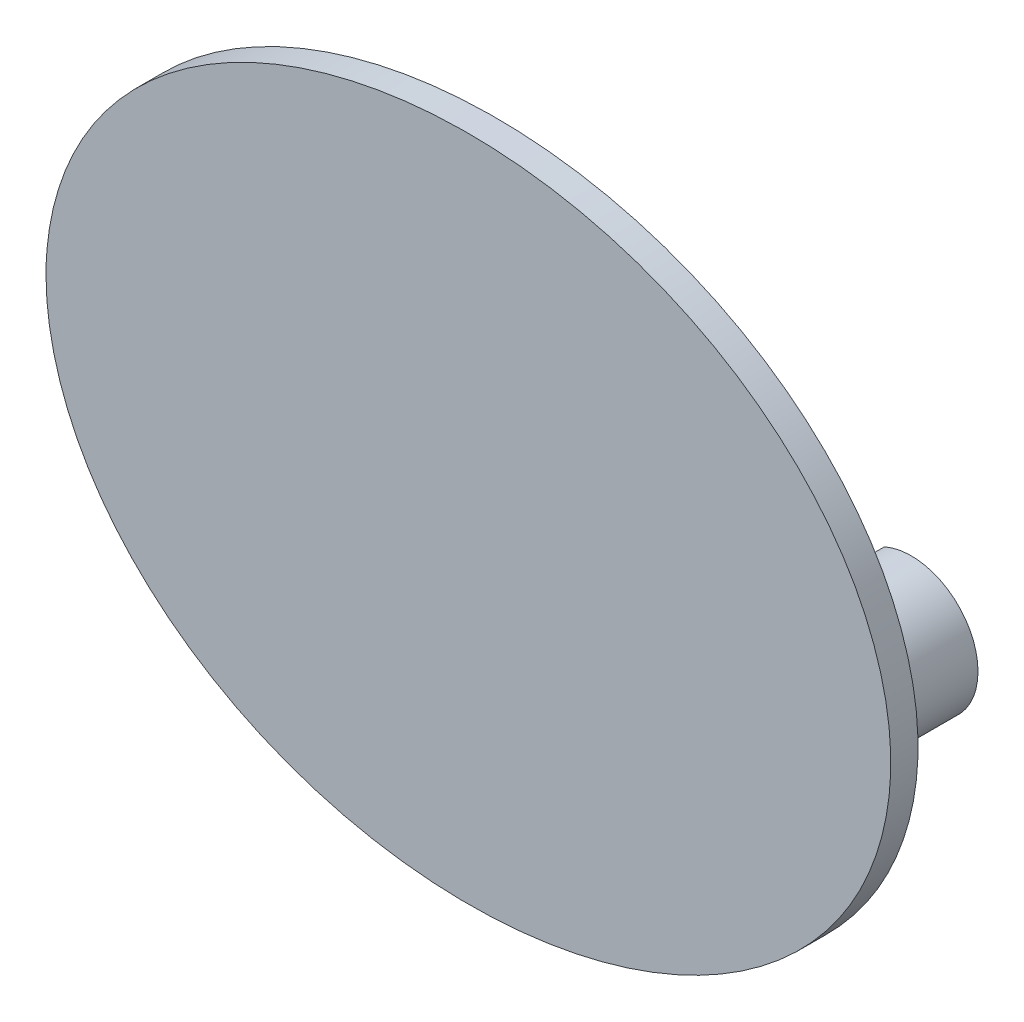
from build123d import *

# Parameters (mm, degrees)
BOSS_EXTRUDE1_DEPTH = 2
BOSS_EXTRUDE2_DEPTH = 7
CUT_EXTRUDE3_DEPTH  = 2.5


# Read off the part's stored shape, not the designer's step: Boss-Extrude1
with BuildPart() as part:
    # Boss-Extrude1 outline → Boss-Extrude1 (new body)
    with BuildSketch(Plane.XY):
        with BuildLine():
            add(Edge.make_bspline(
                [(-31, 0), (-31, -3.366346592), (-29.206076059, -10.099039775), (-22.015870133, -18.167897158), (-11.794763727, -23.318217271), (0, -25.090891365), (11.794763727, -23.318217271), (22.015870133, -18.167897158), (29.206076059, -10.099039775), (31.896961971, 0), (29.206076059, 10.099039775), (22.015870133, 18.167897158), (11.794763727, 23.318217271), (0, 25.090891365), (-11.794763727, 23.318217271), (-22.015870133, 18.167897158), (-29.206076059, 10.099039775), (-31, 3.366346592), (-31, 0)],
                knots=[0, 0, 0, 0, 0.392699082, 0.785398163, 1.178097245, 1.570796327, 1.963495408, 2.35619449, 2.748893572, 3.141592654, 3.534291735, 3.926990817, 4.319689899, 4.71238898, 5.105088062, 5.497787144, 5.890486225, 6.283185307, 6.283185307, 6.283185307, 6.283185307], degree=3))
        make_face()
    extrude(amount=BOSS_EXTRUDE1_DEPTH)

    # Sketch3 → Boss-Extrude2 (add)
    with BuildSketch(Plane.XY):
        with BuildLine():
            ThreePointArc((-21.537021277, 4.489622983), (-28.4, 0), (-21.537021277, -4.489622983))
            ThreePointArc((-21.537021277, -4.489622983), (-21.840862575, -2.641348512), (-21.986382979, -0.773927331))
            ThreePointArc((-21.986382979, -0.773927331), (-25.2, 0), (-21.986382979, 0.773927331))
            ThreePointArc((-21.986382979, 0.773927331), (-21.840862575, 2.641348512), (-21.537021277, 4.489622983))
        make_face()
        with BuildLine():
            ThreePointArc((21.537021277, -4.489622983), (28.4, 0), (21.537021277, 4.489622983))
            ThreePointArc((21.537021277, 4.489622983), (21.840862575, 2.641348512), (21.986382979, 0.773927331))
            ThreePointArc((21.986382979, 0.773927331), (25.2, 0), (21.986382979, -0.773927331))
            ThreePointArc((21.986382979, -0.773927331), (21.840862575, -2.641348512), (21.537021277, -4.489622983))
        make_face()
    extrude(amount=-BOSS_EXTRUDE2_DEPTH)

    # Sketch4 → Cut-Extrude3 (cut)
    with BuildSketch(Plane(origin=(0, 0, -5.4), x_dir=(-1, 0, 0), z_dir=(0, 0, -1))):
        with BuildLine():
            Line((-24.5, 2.9), (24.5, 2.9))
            ThreePointArc((24.5, 2.9), (27.4, 0), (24.5, -2.9))
            Line((24.5, -2.9), (-24.5, -2.9))
            ThreePointArc((-24.5, -2.9), (-27.4, 0), (-24.5, 2.9))
        make_face()
    extrude(amount=-CUT_EXTRUDE3_DEPTH, mode=Mode.SUBTRACT)


solid = part.part
